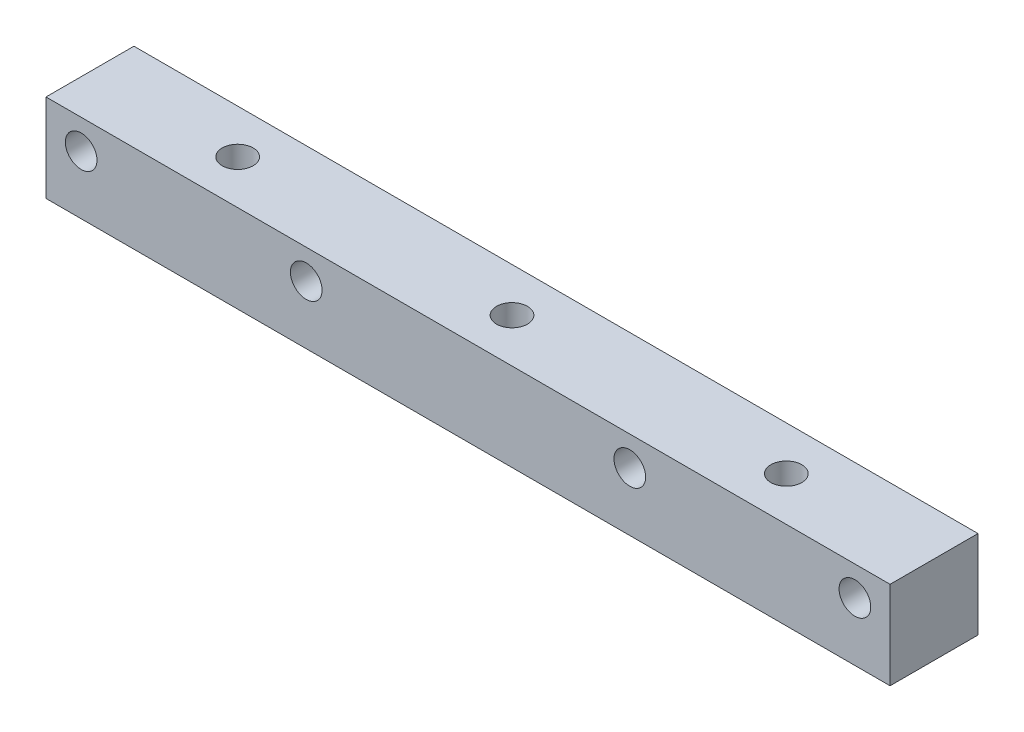
from build123d import *

# Parameters (mm, degrees)
SKETCH1_W             = 12.5
SKETCH1_H             = 12.5
BOSS_EXTRUDE1_DEPTH   = 60
F_4_0MM_DOWEL_HOLE1_D = 4.5
F_1_0MM_DOWEL_HOLE1_D = 4.4


with BuildPart() as part:
    # Sketch1 → Boss-Extrude1 (new, symmetric)
    with BuildSketch(Plane(origin=(0, 0, 0), x_dir=(0, 0, -1), z_dir=(1, 0, 0))):
        Rectangle(SKETCH1_W, SKETCH1_H)
    extrude(amount=BOSS_EXTRUDE1_DEPTH, both=True)

    # Ø4.0mm Dowel Hole1 (through all)
    with Locations(Plane.XY.offset(6.25)):
        with Locations((-55, 2.07), (-23, 2.07), (23, 2.07), (55, 2.07)):
            Hole(F_4_0MM_DOWEL_HOLE1_D / 2)

    # Ø1.0mm Dowel Hole1 (through all)
    with Locations(Plane(origin=(0, 6.25, 0), x_dir=(1, 0, 0), z_dir=(0, 1, 0))):
        with Locations((-39, 0), (0, 0), (39, 0)):
            Hole(F_1_0MM_DOWEL_HOLE1_D / 2)


solid = part.part
